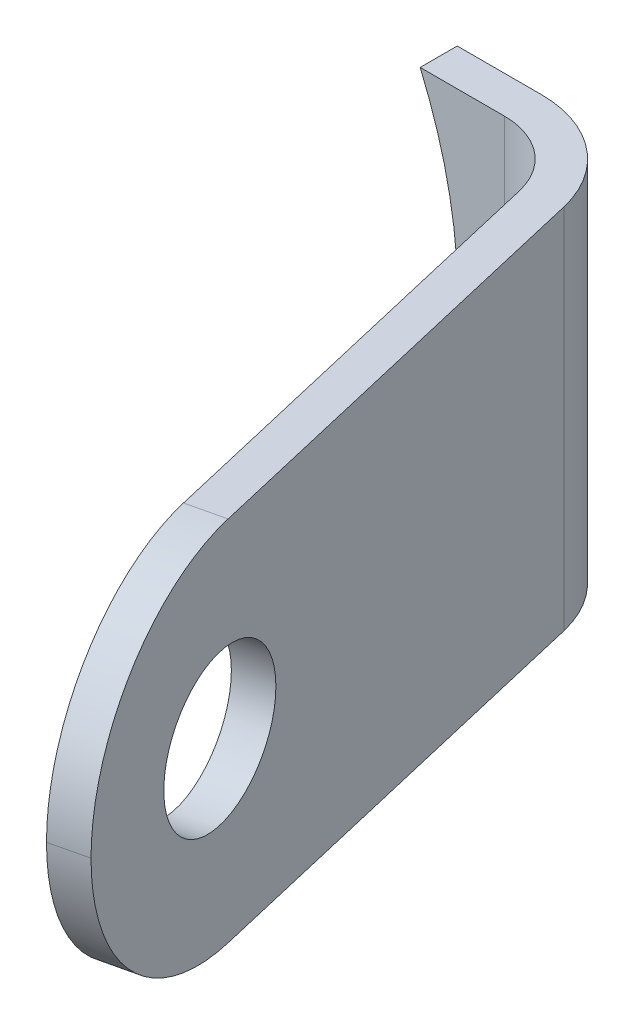
from build123d import *

# Parameters (mm, degrees)
EXTRUDE1_DEPTH                   = 2.5146
EXTRUDE1_DEPTH_BACK              = 2.5146
FILLET1_R                        = 2.5146
EXTRUDE2_DEPTH                   = 0.508
F_97_0_0059_DIAMETER_HOLE1_D     = 2.0574
F_97_0_0059_DIAMETER_HOLE1_DEPTH = 6.35


with BuildPart() as part:
    # Sketch1 → Extrude1 (new, two sides: drawn at the far end of the back side and taken through both)
    with BuildSketch(Plane(origin=(0, 0, 0), x_dir=(1, 0, 0), z_dir=(0, 1, 0)).offset(-EXTRUDE1_DEPTH_BACK)):
        with BuildLine():
            Line((-15.145893147, 13.572089242), (-15.145893147, 13.064089242))
            Line((-15.145893147, 13.064089242), (-15.112093192, 13.064089242))
            ThreePointArc((-15.112093192, 13.064089242), (-14.480623322, 12.844017507), (-14.122713826, 12.279140036))
            Line((-14.122713826, 12.279140036), (-12.14899346, 3.827499715))
            Line((-12.14899346, 3.827499715), (-11.654303777, 3.943025112))
            Line((-11.654303777, 3.943025112), (-13.628024142, 12.394665433))
            ThreePointArc((-13.628024142, 12.394665433), (-14.164888387, 13.24198164), (-15.112093192, 13.572089242))
            Line((-15.112093192, 13.572089242), (-15.145893147, 13.572089242))
        make_face()
    extrude(amount=EXTRUDE1_DEPTH + EXTRUDE1_DEPTH_BACK)

    # Fillet1
    fillet1_edges = [part.edges().sort_by_distance(p)[0] for p in [
        (-11.901648619, -2.5146, -3.885262414),
        (-11.901648619, 2.5146, -3.885262414),
    ]]
    fillet(fillet1_edges, radius=FILLET1_R - 0.0001)  # a hair under: the kernel refuses the full size

    # Sketch2 → Extrude2 (add)
    with BuildSketch(Plane(origin=(0, 0, -13.572089242), x_dir=(-1, 0, 0), z_dir=(0, 0, -1))):
        with BuildLine():
            Line((15.145893147, 2.5146), (15.145893147, -2.5146))
            Line((15.145893147, -2.5146), (16.267109258, -2.5146))
            ThreePointArc((16.267109258, -2.5146), (15.748, 0), (16.267109258, 2.5146))
            Line((16.267109258, 2.5146), (15.145893147, 2.5146))
        make_face()
    extrude(amount=-EXTRUDE2_DEPTH)

    # #97 (0.0059) Diameter Hole1
    with Locations(Plane(origin=(-12.191883936, 0, -6.244989577), x_dir=(0.227412198577, 0, 0.973798589), z_dir=(0.973798589, 0, -0.227412198577))):
        with Locations((0, 0)):
            Hole(F_97_0_0059_DIAMETER_HOLE1_D / 2, depth=F_97_0_0059_DIAMETER_HOLE1_DEPTH)


solid = part.part
